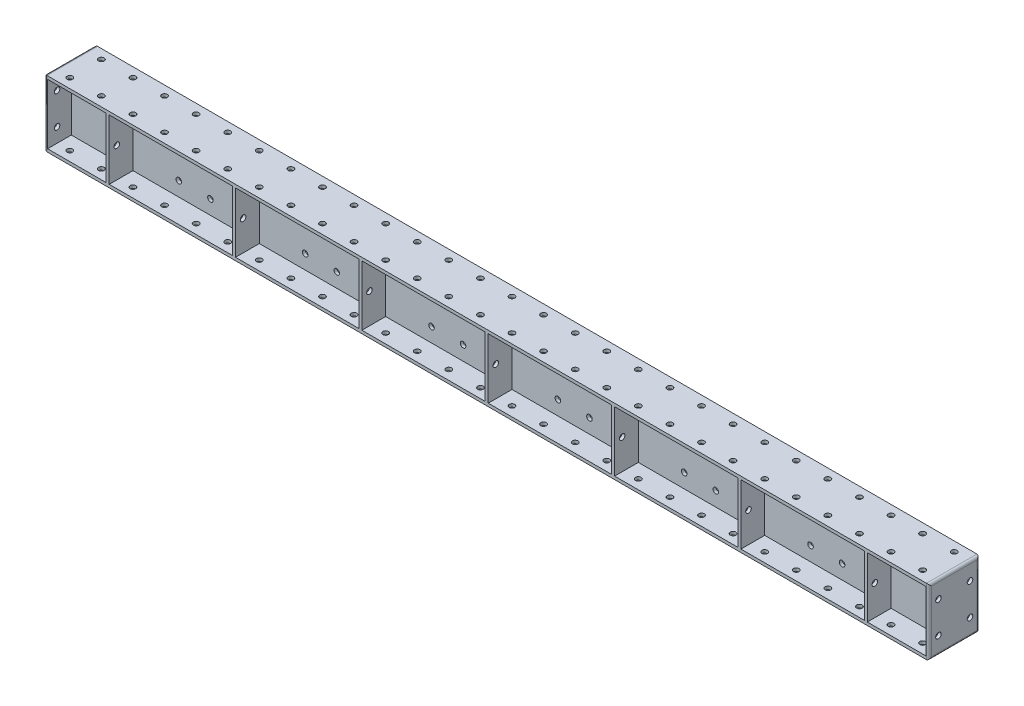
from build123d import *

# Parameters (mm, degrees)
SKETCH_1_W                         = 3500
SKETCH_1_H                         = 262
EXTRUDE_1_DEPTH                    = 200
SKETCH_5_W                         = 232
SKETCH_5_H                         = 238
SKETCH_5_W_2                       = 488
CUT_EXTRUDE_10_DEPTH               = 3516.486310598
SKETCH_7_W                         = 3500
SKETCH_7_H                         = 12
EXTRUDE_13_DEPTH                   = 260
SKETCH_8_R                         = 11
CUT_EXTRUDE_14_DEPTH               = 3516.486310598
PATTERN_LINEAR_3_COUNT             = 28
PATTERN_LINEAR_3_PITCH             = 125
PATTERN_LINEAR_3_COUNT_DIR2        = 2
PATTERN_LINEAR_3_PITCH_DIR2        = 125
SKETCH_10_R                        = 11
CUT_EXTRUDE_16_DEPTH               = 20
PATTERN_LINEAR_5_COUNT             = 2
PATTERN_LINEAR_5_PITCH             = 125
PATTERN_LINEAR_5_COUNT_DIR2        = 2
PATTERN_LINEAR_5_PITCH_DIR2        = 125
CUT_EXTRUDE_START                  = -20
SKETCH_11_R                        = 11
CUT_EXTRUDE_17_DEPTH               = 20
PATTERN_LINEAR_6_COUNT             = 2
PATTERN_LINEAR_6_PITCH             = 125
PATTERN_LINEAR_6_COUNT_DIR2        = 2
PATTERN_LINEAR_6_PITCH_DIR2        = 125
SKETCH_12_R                        = 11
CUT_EXTRUDE_18_DEPTH               = 3020
PATTERN_LINEAR_8_COUNT             = 2
PATTERN_LINEAR_8_PITCH             = 140.2426687
FILLET_1_R                         = 10
FILLET_2_R                         = 10
SKETCH_13_R                        = 11
CUT_EXTRUDE_19_DEPTH               = 3512.392886021
PATTERN_LINEAR_9_COUNT             = 2
PATTERN_LINEAR_9_PITCH             = 125
PATTERN_LINEAR_9_COUNT_DIR2        = 2
PATTERN_LINEAR_9_PITCH_DIR2        = 125
PATTERN_LINEAR_10_COUNT            = 6
PATTERN_LINEAR_10_PITCH            = 500
PATTERN_LINEAR_10_COPY_1_SKETCH_R  = 11
PATTERN_LINEAR_10_COPY_1_DEPTH     = 3512.392886021
PATTERN_LINEAR_10_COPY_2_SKETCH_R  = 11
PATTERN_LINEAR_10_COPY_2_DEPTH     = 3512.392886021
PATTERN_LINEAR_10_COPY_3_SKETCH_R  = 11
PATTERN_LINEAR_10_COPY_3_DEPTH     = 3512.392886021
PATTERN_LINEAR_10_COPY_4_SKETCH_R  = 11
PATTERN_LINEAR_10_COPY_4_DEPTH     = 3512.392886021
PATTERN_LINEAR_10_COPY_5_SKETCH_R  = 11
PATTERN_LINEAR_10_COPY_5_DEPTH     = 3512.392886021
PATTERN_LINEAR_10_COPY_6_SKETCH_R  = 11
PATTERN_LINEAR_10_COPY_6_DEPTH     = 3512.392886021
PATTERN_LINEAR_10_COPY_7_SKETCH_R  = 11
PATTERN_LINEAR_10_COPY_7_DEPTH     = 3512.392886021
PATTERN_LINEAR_10_COPY_8_SKETCH_R  = 11
PATTERN_LINEAR_10_COPY_8_DEPTH     = 3512.392886021
PATTERN_LINEAR_10_COPY_9_SKETCH_R  = 11
PATTERN_LINEAR_10_COPY_9_DEPTH     = 3512.392886021
PATTERN_LINEAR_10_COPY_10_SKETCH_R = 11
PATTERN_LINEAR_10_COPY_10_DEPTH    = 3512.392886021
PATTERN_LINEAR_10_COPY_11_SKETCH_R = 11
PATTERN_LINEAR_10_COPY_11_DEPTH    = 3512.392886021
PATTERN_LINEAR_10_COPY_12_SKETCH_R = 11
PATTERN_LINEAR_10_COPY_12_DEPTH    = 3512.392886021
PATTERN_LINEAR_10_COPY_13_SKETCH_R = 11
PATTERN_LINEAR_10_COPY_13_DEPTH    = 3512.392886021
PATTERN_LINEAR_10_COPY_14_SKETCH_R = 11
PATTERN_LINEAR_10_COPY_14_DEPTH    = 3512.392886021
PATTERN_LINEAR_10_COPY_15_SKETCH_R = 11
PATTERN_LINEAR_10_COPY_15_DEPTH    = 3512.392886021


with BuildPart() as part:
    # 草图1 → 拉伸1 (new body)
    with BuildSketch(Plane.XY):
        with Locations((1750, 131)):
            Rectangle(SKETCH_1_W, SKETCH_1_H)
    extrude(amount=EXTRUDE_1_DEPTH)

    # 草图5 → 拉伸10 (cut, through all)
    with BuildSketch(Plane.XY.offset(200)):
        with Locations((128, 131)):
            Rectangle(SKETCH_5_W, SKETCH_5_H)
        with Locations((500, 131)):
            Rectangle(SKETCH_5_W_2, SKETCH_5_H)
        with Locations((1000, 131)):
            Rectangle(SKETCH_5_W_2, SKETCH_5_H)
        with Locations((1500, 131)):
            Rectangle(SKETCH_5_W_2, SKETCH_5_H)
        with Locations((2000, 131)):
            Rectangle(SKETCH_5_W_2, SKETCH_5_H)
        with Locations((2500, 131)):
            Rectangle(SKETCH_5_W_2, SKETCH_5_H)
        with Locations((3000, 131)):
            Rectangle(SKETCH_5_W_2, SKETCH_5_H)
        with Locations((3372, 131)):
            Rectangle(SKETCH_5_W, SKETCH_5_H)
    extrude(amount=-CUT_EXTRUDE_10_DEPTH, mode=Mode.SUBTRACT)

    # 草图7 → 拉伸13 (add)
    with BuildSketch(Plane.XZ):
        with Locations((1750, 100)):
            Rectangle(SKETCH_7_W, SKETCH_7_H)
    extrude(amount=-EXTRUDE_13_DEPTH)

    # 草图8 → 拉伸14 (cut, through all)
    with BuildSketch(Plane.XZ):
        with Locations((62.5, 37.5)):
            Circle(SKETCH_8_R)
    cut_extrude_14 = extrude(amount=-CUT_EXTRUDE_14_DEPTH, mode=Mode.SUBTRACT)

    # 阵列(线性)3: Cut-Extrude 14 28 × 2
    with Locations(*[(i * PATTERN_LINEAR_3_PITCH, 0, j * PATTERN_LINEAR_3_PITCH_DIR2) for i in range(PATTERN_LINEAR_3_COUNT) for j in range(PATTERN_LINEAR_3_COUNT_DIR2) if (i, j) != (0, 0)]):
        add(cut_extrude_14, mode=Mode.SUBTRACT)

    # 草图10 → 拉伸16 (cut)
    with BuildSketch(Plane.ZY):
        with Locations((37.5, 68.5)):
            Circle(SKETCH_10_R)
    cut_extrude_16 = extrude(amount=-CUT_EXTRUDE_16_DEPTH, mode=Mode.SUBTRACT)

    # 阵列(线性)5: Cut-Extrude 16 2 × 2
    with Locations(*[(0, j * PATTERN_LINEAR_5_PITCH_DIR2, i * PATTERN_LINEAR_5_PITCH) for i in range(PATTERN_LINEAR_5_COUNT) for j in range(PATTERN_LINEAR_5_COUNT_DIR2) if (i, j) != (0, 0)]):
        add(cut_extrude_16, mode=Mode.SUBTRACT)

    # 草图11 → 拉伸17 (cut)
    with BuildSketch(Plane(origin=(3500, 0, 0), x_dir=(0, 0, -1), z_dir=(1, 0, 0)).offset(CUT_EXTRUDE_START)):
        with Locations((-162.5, 68.5)):
            Circle(SKETCH_11_R)
    cut_extrude_17 = extrude(amount=CUT_EXTRUDE_17_DEPTH, mode=Mode.SUBTRACT)

    # 阵列(线性)6: Cut-Extrude 17 2 × 2
    with Locations(*[(0, j * PATTERN_LINEAR_6_PITCH_DIR2, -i * PATTERN_LINEAR_6_PITCH) for i in range(PATTERN_LINEAR_6_COUNT) for j in range(PATTERN_LINEAR_6_COUNT_DIR2) if (i, j) != (0, 0)]):
        add(cut_extrude_17, mode=Mode.SUBTRACT)

    # 草图12 → 拉伸18 (cut)
    with BuildSketch(Plane(origin=(3256, 0, 0), x_dir=(0, 0, -1), z_dir=(1, 0, 0))):
        with Locations((-170.12133435, 131)):
            Circle(SKETCH_12_R)
    cut_extrude_18 = extrude(amount=-CUT_EXTRUDE_18_DEPTH, mode=Mode.SUBTRACT)

    # 阵列(线性)8: 拉伸18 ×2
    with Locations(*[(0, 0, -i * PATTERN_LINEAR_8_PITCH) for i in range(1, PATTERN_LINEAR_8_COUNT)]):
        add(cut_extrude_18, mode=Mode.SUBTRACT)

    # 圆角1
    fillet_1_edges = [part.edges().sort_by_distance(p)[0] for p in [
        (0, 0, 100),
        (0, 131, 0),
        (0, 131, 200),
        (0, 262, 100),
    ]]
    fillet(fillet_1_edges, radius=FILLET_1_R)

    # 圆角2
    fillet_2_edges = [part.edges().sort_by_distance(p)[0] for p in [
        (3500, 262, 100),
        (3500, 131, 0),
        (3500, 0, 100),
        (3500, 131, 200),
    ]]
    fillet(fillet_2_edges, radius=FILLET_2_R)

    # 草图13 → 拉伸19 (cut, through all)
    with BuildSketch(Plane.XY.offset(106)):
        with Locations((437.5, 68.5)):
            Circle(SKETCH_13_R)
    cut_extrude_19 = extrude(amount=-CUT_EXTRUDE_19_DEPTH, mode=Mode.SUBTRACT)

    # 阵列(线性)9: Cut-Extrude 19 2 × 2
    with Locations(*[(i * PATTERN_LINEAR_9_PITCH, j * PATTERN_LINEAR_9_PITCH_DIR2, 0) for i in range(PATTERN_LINEAR_9_COUNT) for j in range(PATTERN_LINEAR_9_COUNT_DIR2) if (i, j) != (0, 0)]):
        add(cut_extrude_19, mode=Mode.SUBTRACT)

    # 阵列(线性)10: 拉伸19 ×6
    with Locations(*[(i * PATTERN_LINEAR_10_PITCH, 0, 0) for i in range(1, PATTERN_LINEAR_10_COUNT)]):
        add(cut_extrude_19, mode=Mode.SUBTRACT)

    # 阵列(线性)10 copy 1 sketch → 阵列(线性)10 copy 1 (cut, through all)
    with BuildSketch(Plane(origin=(500, 125, 106), x_dir=(1, 0, 0), z_dir=(0, 0, 1))):
        with Locations((437.5, 68.5)):
            Circle(PATTERN_LINEAR_10_COPY_1_SKETCH_R)
    extrude(amount=-PATTERN_LINEAR_10_COPY_1_DEPTH, mode=Mode.SUBTRACT)

    # 阵列(线性)10 copy 2 sketch → 阵列(线性)10 copy 2 (cut, through all)
    with BuildSketch(Plane(origin=(1000, 125, 106), x_dir=(1, 0, 0), z_dir=(0, 0, 1))):
        with Locations((437.5, 68.5)):
            Circle(PATTERN_LINEAR_10_COPY_2_SKETCH_R)
    extrude(amount=-PATTERN_LINEAR_10_COPY_2_DEPTH, mode=Mode.SUBTRACT)

    # 阵列(线性)10 copy 3 sketch → 阵列(线性)10 copy 3 (cut, through all)
    with BuildSketch(Plane(origin=(1500, 125, 106), x_dir=(1, 0, 0), z_dir=(0, 0, 1))):
        with Locations((437.5, 68.5)):
            Circle(PATTERN_LINEAR_10_COPY_3_SKETCH_R)
    extrude(amount=-PATTERN_LINEAR_10_COPY_3_DEPTH, mode=Mode.SUBTRACT)

    # 阵列(线性)10 copy 4 sketch → 阵列(线性)10 copy 4 (cut, through all)
    with BuildSketch(Plane(origin=(2000, 125, 106), x_dir=(1, 0, 0), z_dir=(0, 0, 1))):
        with Locations((437.5, 68.5)):
            Circle(PATTERN_LINEAR_10_COPY_4_SKETCH_R)
    extrude(amount=-PATTERN_LINEAR_10_COPY_4_DEPTH, mode=Mode.SUBTRACT)

    # 阵列(线性)10 copy 5 sketch → 阵列(线性)10 copy 5 (cut, through all)
    with BuildSketch(Plane(origin=(2500, 125, 106), x_dir=(1, 0, 0), z_dir=(0, 0, 1))):
        with Locations((437.5, 68.5)):
            Circle(PATTERN_LINEAR_10_COPY_5_SKETCH_R)
    extrude(amount=-PATTERN_LINEAR_10_COPY_5_DEPTH, mode=Mode.SUBTRACT)

    # 阵列(线性)10 copy 6 sketch → 阵列(线性)10 copy 6 (cut, through all)
    with BuildSketch(Plane(origin=(625, 0, 106), x_dir=(1, 0, 0), z_dir=(0, 0, 1))):
        with Locations((437.5, 68.5)):
            Circle(PATTERN_LINEAR_10_COPY_6_SKETCH_R)
    extrude(amount=-PATTERN_LINEAR_10_COPY_6_DEPTH, mode=Mode.SUBTRACT)

    # 阵列(线性)10 copy 7 sketch → 阵列(线性)10 copy 7 (cut, through all)
    with BuildSketch(Plane(origin=(1125, 0, 106), x_dir=(1, 0, 0), z_dir=(0, 0, 1))):
        with Locations((437.5, 68.5)):
            Circle(PATTERN_LINEAR_10_COPY_7_SKETCH_R)
    extrude(amount=-PATTERN_LINEAR_10_COPY_7_DEPTH, mode=Mode.SUBTRACT)

    # 阵列(线性)10 copy 8 sketch → 阵列(线性)10 copy 8 (cut, through all)
    with BuildSketch(Plane(origin=(1625, 0, 106), x_dir=(1, 0, 0), z_dir=(0, 0, 1))):
        with Locations((437.5, 68.5)):
            Circle(PATTERN_LINEAR_10_COPY_8_SKETCH_R)
    extrude(amount=-PATTERN_LINEAR_10_COPY_8_DEPTH, mode=Mode.SUBTRACT)

    # 阵列(线性)10 copy 9 sketch → 阵列(线性)10 copy 9 (cut, through all)
    with BuildSketch(Plane(origin=(2125, 0, 106), x_dir=(1, 0, 0), z_dir=(0, 0, 1))):
        with Locations((437.5, 68.5)):
            Circle(PATTERN_LINEAR_10_COPY_9_SKETCH_R)
    extrude(amount=-PATTERN_LINEAR_10_COPY_9_DEPTH, mode=Mode.SUBTRACT)

    # 阵列(线性)10 copy 10 sketch → 阵列(线性)10 copy 10 (cut, through all)
    with BuildSketch(Plane(origin=(2625, 0, 106), x_dir=(1, 0, 0), z_dir=(0, 0, 1))):
        with Locations((437.5, 68.5)):
            Circle(PATTERN_LINEAR_10_COPY_10_SKETCH_R)
    extrude(amount=-PATTERN_LINEAR_10_COPY_10_DEPTH, mode=Mode.SUBTRACT)

    # 阵列(线性)10 copy 11 sketch → 阵列(线性)10 copy 11 (cut, through all)
    with BuildSketch(Plane(origin=(625, 125, 106), x_dir=(1, 0, 0), z_dir=(0, 0, 1))):
        with Locations((437.5, 68.5)):
            Circle(PATTERN_LINEAR_10_COPY_11_SKETCH_R)
    extrude(amount=-PATTERN_LINEAR_10_COPY_11_DEPTH, mode=Mode.SUBTRACT)

    # 阵列(线性)10 copy 12 sketch → 阵列(线性)10 copy 12 (cut, through all)
    with BuildSketch(Plane(origin=(1125, 125, 106), x_dir=(1, 0, 0), z_dir=(0, 0, 1))):
        with Locations((437.5, 68.5)):
            Circle(PATTERN_LINEAR_10_COPY_12_SKETCH_R)
    extrude(amount=-PATTERN_LINEAR_10_COPY_12_DEPTH, mode=Mode.SUBTRACT)

    # 阵列(线性)10 copy 13 sketch → 阵列(线性)10 copy 13 (cut, through all)
    with BuildSketch(Plane(origin=(1625, 125, 106), x_dir=(1, 0, 0), z_dir=(0, 0, 1))):
        with Locations((437.5, 68.5)):
            Circle(PATTERN_LINEAR_10_COPY_13_SKETCH_R)
    extrude(amount=-PATTERN_LINEAR_10_COPY_13_DEPTH, mode=Mode.SUBTRACT)

    # 阵列(线性)10 copy 14 sketch → 阵列(线性)10 copy 14 (cut, through all)
    with BuildSketch(Plane(origin=(2125, 125, 106), x_dir=(1, 0, 0), z_dir=(0, 0, 1))):
        with Locations((437.5, 68.5)):
            Circle(PATTERN_LINEAR_10_COPY_14_SKETCH_R)
    extrude(amount=-PATTERN_LINEAR_10_COPY_14_DEPTH, mode=Mode.SUBTRACT)

    # 阵列(线性)10 copy 15 sketch → 阵列(线性)10 copy 15 (cut, through all)
    with BuildSketch(Plane(origin=(2625, 125, 106), x_dir=(1, 0, 0), z_dir=(0, 0, 1))):
        with Locations((437.5, 68.5)):
            Circle(PATTERN_LINEAR_10_COPY_15_SKETCH_R)
    extrude(amount=-PATTERN_LINEAR_10_COPY_15_DEPTH, mode=Mode.SUBTRACT)


solid = part.part
